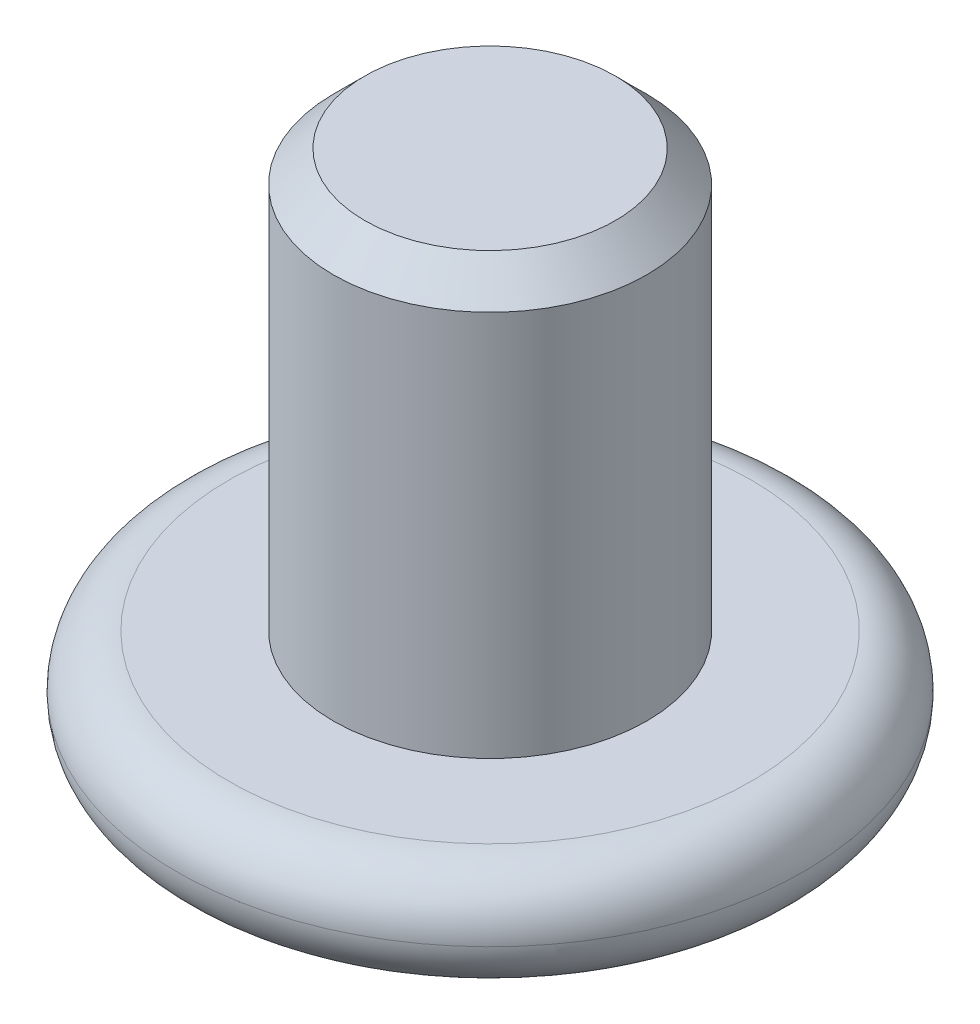
from build123d import *

# Parameters (mm, degrees)
SKETCH_2_R          = 1.5
EXTRUDE_1_DEPTH     = 4
SKETCH_3_R          = 3
EXTRUDE_2_DEPTH     = 1
FILLET_1_R          = 0.5
CUT_EXTRUDE_2_DEPTH = 0.5
CHAMFER_1_SIZE      = 0.3


with BuildPart() as part:
    # 草图2 → 凸台-拉伸1 (new body)
    with BuildSketch(Plane(origin=(0, 0, 0), x_dir=(1, 0, 0), z_dir=(0, 1, 0))):
        with Locations(Location((0, 0, 0), (0, 0, 270))):
            Circle(SKETCH_2_R)
    extrude(amount=EXTRUDE_1_DEPTH)

    # 草图3 → 凸台-拉伸2 (add)
    with BuildSketch(Plane.XZ):
        with Locations(Location((0, 0, 0), (0, 0, 270))):
            Circle(SKETCH_3_R)
    extrude(amount=EXTRUDE_2_DEPTH)

    # 圆角1
    fillet_1_edges = [part.edges().sort_by_distance(p)[0] for p in [
        (0, 0, 3),
        (0, -1, 3),
    ]]
    fillet(fillet_1_edges, radius=FILLET_1_R - 0.0001)  # a hair under: the kernel refuses the full size

    # 草图4 → 切除-拉伸2 (cut)
    with BuildSketch(Plane.XZ.offset(1)):
        Polygon((-1.5, -0.2), (-0.2, -0.2), (-0.2, -1.5), (0.2, -1.5), (0.2, -0.2), (1.5, -0.2), (1.5, 0.2), (0.2, 0.2), (0.2, 1.5), (-0.2, 1.5), (-0.2, 0.2), (-1.5, 0.2), align=None)
    extrude(amount=-CUT_EXTRUDE_2_DEPTH, mode=Mode.SUBTRACT)

    # 倒角1
    chamfer_1_edges = [part.edges().sort_by_distance(p)[0] for p in [
        (0, 4, -1.5),
    ]]
    chamfer(chamfer_1_edges, length=CHAMFER_1_SIZE)


solid = part.part
